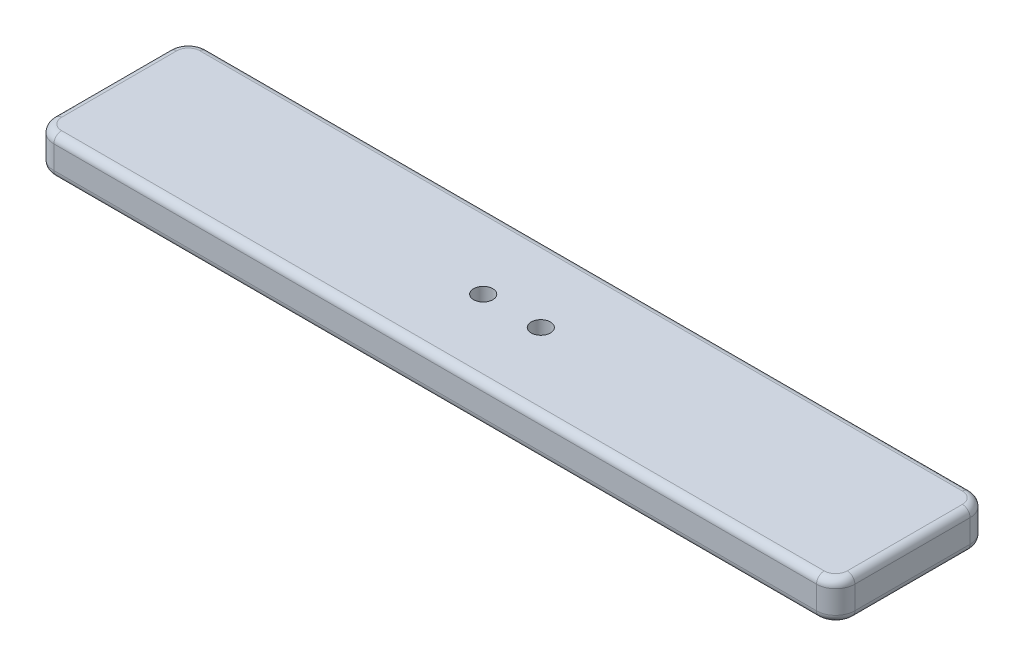
from build123d import *

# Parameters (mm, degrees)
SKETCH1_W           = 264.903089326
SKETCH1_H           = 50.8
BOSS_EXTRUDE1_DEPTH = 12.7
FILLET1_R           = 6.35
FILLET2_R           = 2.54
SKETCH2_R           = 3.175
CUT_EXTRUDE1_DEPTH  = 290.624468155


with BuildPart() as part:
    # Sketch1 → Boss-Extrude1 (new body)
    with BuildSketch(Plane(origin=(0, 0, 0), x_dir=(1, 0, 0), z_dir=(0, 1, 0))):
        with Locations((152.4, 25.4)):
            Rectangle(SKETCH1_W, SKETCH1_H)
    extrude(amount=BOSS_EXTRUDE1_DEPTH)

    # Fillet1
    fillet1_edges = [part.edges().sort_by_distance(p)[0] for p in [
        (284.851544663, 6.35, -50.8),
        (284.851544663, 6.35, 0),
        (19.948455337, 6.35, -50.8),
        (19.948455337, 6.35, 0),
    ]]
    fillet(fillet1_edges, radius=FILLET1_R)

    # Fillet2
    fillet2_edges = [part.edges().sort_by_distance(p)[0] for p in [
        (21.808327276, 0, -48.940128061),
        (19.948455337, 0, -25.4),
        (21.808327276, 0, -1.859871939),
        (152.4, 0, 0),
        (282.991672724, 0, -1.859871939),
        (284.851544663, 0, -25.4),
        (282.991672724, 0, -48.940128061),
        (152.4, 0, -50.8),
        (282.991672724, 12.7, -1.859871939),
        (152.4, 12.7, 0),
        (21.808327276, 12.7, -1.859871939),
        (19.948455337, 12.7, -25.4),
        (21.808327276, 12.7, -48.940128061),
        (152.4, 12.7, -50.8),
        (282.991672724, 12.7, -48.940128061),
        (284.851544663, 12.7, -25.4),
    ]]
    fillet(fillet2_edges, radius=FILLET2_R)

    # Sketch2 → Cut-Extrude1 (cut, through all)
    with BuildSketch(Plane(origin=(0, 12.7, 0), x_dir=(1, 0, 0), z_dir=(0, 1, 0))):
        with Locations((142.875, 25.4)):
            Circle(SKETCH2_R)
        with Locations((161.925, 25.4)):
            Circle(SKETCH2_R)
    extrude(amount=-CUT_EXTRUDE1_DEPTH, mode=Mode.SUBTRACT)


solid = part.part
